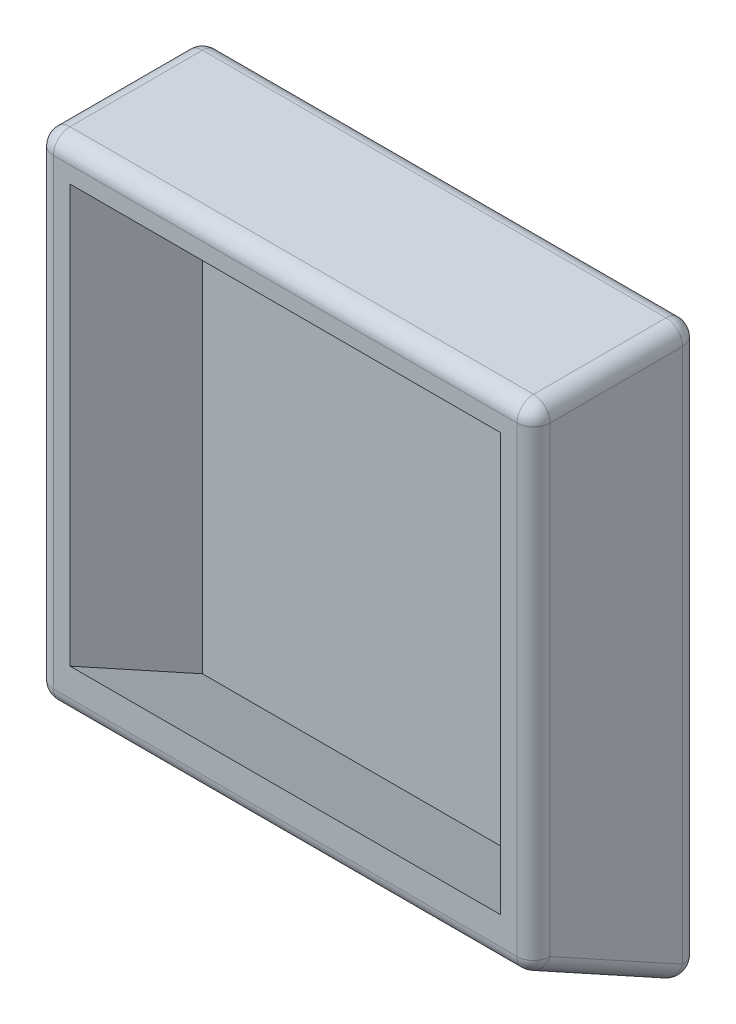
from build123d import *

# Parameters (mm, degrees)
SKETCH1_W           = 300
SKETCH1_H           = 350
BOSS_EXTRUDE1_DEPTH = 100
CUT_EXTRUDE1_DEPTH  = 362.42080737
FILLET1_R           = 10
SHELL1_START        = -130
SHELL1_DEPTH        = 260


# Read off the part's stored shape, not the designer's step: Shell1
with BuildPart() as part:
    # Sketch1 → Boss-Extrude1 (new body)
    with BuildSketch(Plane.XY):
        Rectangle(SKETCH1_W, SKETCH1_H)
    extrude(amount=BOSS_EXTRUDE1_DEPTH)

    # Sketch2 → Cut-Extrude1 (cut, through all)
    with BuildSketch(Plane.ZY.offset(150)):
        Polygon((0, -175), (100, -120), (100, -175), align=None)
    extrude(amount=-CUT_EXTRUDE1_DEPTH, mode=Mode.SUBTRACT)

    # Fillet1
    fillet1_edges = [part.edges().sort_by_distance(p)[0] for p in [
        (150, 27.5, 100),
        (150, -147.5, 50),
        (0, -120, 100),
        (-150, -147.5, 50),
        (0, 175, 100),
        (150, 0, 0),
        (0, -175, 0),
        (-150, 0, 0),
        (0, 175, 0),
        (150, 175, 50),
        (-150, 175, 50),
        (-150, 27.5, 100),
    ]]
    fillet(fillet1_edges, radius=FILLET1_R)

    # Shell1 outline → Shell1 (cut)
    with BuildSketch(Plane.YZ.offset(SHELL1_START)):
        Polygon((155, 20), (155, 100), (-97.174575579, 100), (-141.174575579, 20), align=None)
    extrude(amount=SHELL1_DEPTH, mode=Mode.SUBTRACT)


solid = part.part
